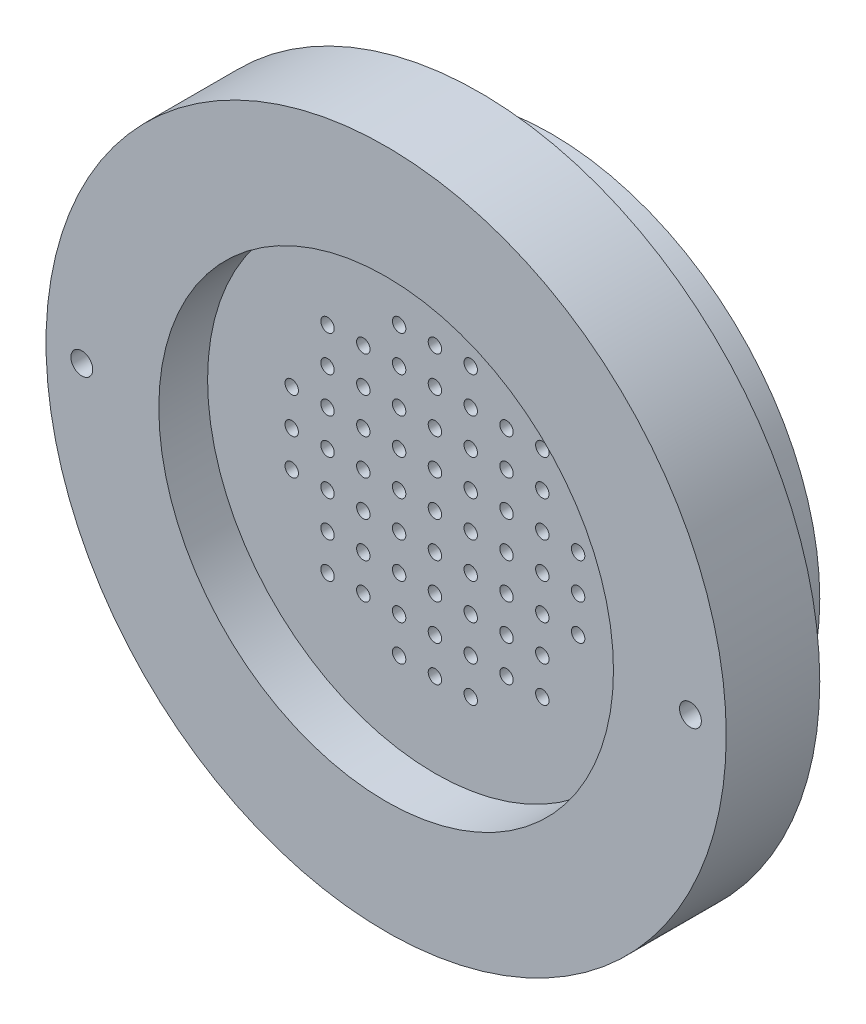
from build123d import *

# Parameters (mm, degrees)
SKETCH1_R                                           = 38
BOSS_EXTRUDE1_DEPTH                                 = 5
SKETCH2_R                                           = 0.75
CUT_EXTRUDE1_DEPTH                                  = 54.972215074
LPATTERN1_COUNT                                     = 5
LPATTERN1_PITCH                                     = 4
LPATTERN1_COUNT_DIR2                                = 5
LPATTERN1_PITCH_DIR2                                = 4
MIRROR1_COPY_1_SKETCH_R                             = 0.75
MIRROR1_COPY_1_DEPTH                                = 54.972215074
MIRROR1_COPY_2_SKETCH_R                             = 0.75
MIRROR1_COPY_2_DEPTH                                = 54.972215074
MIRROR1_COPY_3_SKETCH_R                             = 0.75
MIRROR1_COPY_3_DEPTH                                = 54.972215074
MIRROR1_COPY_4_SKETCH_R                             = 0.75
MIRROR1_COPY_4_DEPTH                                = 54.972215074
MIRROR1_COPY_5_SKETCH_R                             = 0.75
MIRROR1_COPY_5_DEPTH                                = 54.972215074
MIRROR1_COPY_6_SKETCH_R                             = 0.75
MIRROR1_COPY_6_DEPTH                                = 54.972215074
MIRROR1_COPY_7_SKETCH_R                             = 0.75
MIRROR1_COPY_7_DEPTH                                = 54.972215074
MIRROR1_COPY_8_SKETCH_R                             = 0.75
MIRROR1_COPY_8_DEPTH                                = 54.972215074
MIRROR1_COPY_9_SKETCH_R                             = 0.75
MIRROR1_COPY_9_DEPTH                                = 54.972215074
MIRROR1_COPY_10_SKETCH_R                            = 0.75
MIRROR1_COPY_10_DEPTH                               = 54.972215074
MIRROR1_COPY_11_SKETCH_R                            = 0.75
MIRROR1_COPY_11_DEPTH                               = 54.972215074
MIRROR1_COPY_12_SKETCH_R                            = 0.75
MIRROR1_COPY_12_DEPTH                               = 54.972215074
MIRROR1_COPY_13_SKETCH_R                            = 0.75
MIRROR1_COPY_13_DEPTH                               = 54.972215074
MIRROR1_COPY_14_SKETCH_R                            = 0.75
MIRROR1_COPY_14_DEPTH                               = 54.972215074
MIRROR1_COPY_15_SKETCH_R                            = 0.75
MIRROR1_COPY_15_DEPTH                               = 54.972215074
MIRROR1_COPY_16_SKETCH_R                            = 0.75
MIRROR1_COPY_16_DEPTH                               = 54.972215074
MIRROR1_COPY_17_SKETCH_R                            = 0.75
MIRROR1_COPY_17_DEPTH                               = 54.972215074
MIRROR1_COPY_18_SKETCH_R                            = 0.75
MIRROR1_COPY_18_DEPTH                               = 54.972215074
MIRROR1_COPY_19_SKETCH_R                            = 0.75
MIRROR1_COPY_19_DEPTH                               = 54.972215074
MIRROR1_COPY_20_SKETCH_R                            = 0.75
MIRROR1_COPY_20_DEPTH                               = 54.972215074
MIRROR1_AT_THE_SECOND_PLANE_COPY_1_SKETC_R          = 0.75
MIRROR1_AT_THE_SECOND_PLANE_COPY_1_DEPTH            = 54.972215074
MIRROR1_AT_THE_SECOND_PLANE_COPY_2_SKETC_R          = 0.75
MIRROR1_AT_THE_SECOND_PLANE_COPY_2_DEPTH            = 54.972215074
MIRROR1_AT_THE_SECOND_PLANE_COPY_3_SKETC_R          = 0.75
MIRROR1_AT_THE_SECOND_PLANE_COPY_3_DEPTH            = 54.972215074
MIRROR1_AT_THE_SECOND_PLANE_COPY_4_SKETC_R          = 0.75
MIRROR1_AT_THE_SECOND_PLANE_COPY_4_DEPTH            = 54.972215074
MIRROR1_AT_THE_SECOND_PLANE_COPY_5_SKETC_R          = 0.75
MIRROR1_AT_THE_SECOND_PLANE_COPY_5_DEPTH            = 54.972215074
MIRROR1_AT_THE_SECOND_PLANE_COPY_6_SKETC_R          = 0.75
MIRROR1_AT_THE_SECOND_PLANE_COPY_6_DEPTH            = 54.972215074
MIRROR1_AT_THE_SECOND_PLANE_COPY_7_SKETC_R          = 0.75
MIRROR1_AT_THE_SECOND_PLANE_COPY_7_DEPTH            = 54.972215074
MIRROR1_AT_THE_SECOND_PLANE_COPY_8_SKETC_R          = 0.75
MIRROR1_AT_THE_SECOND_PLANE_COPY_8_DEPTH            = 54.972215074
MIRROR1_AT_THE_SECOND_PLANE_COPY_9_SKETC_R          = 0.75
MIRROR1_AT_THE_SECOND_PLANE_COPY_9_DEPTH            = 54.972215074
MIRROR1_AT_THE_SECOND_PLANE_COPY_10_SKET_R          = 0.75
MIRROR1_AT_THE_SECOND_PLANE_COPY_10_DEPTH           = 54.972215074
MIRROR1_AT_THE_SECOND_PLANE_COPY_11_SKET_R          = 0.75
MIRROR1_AT_THE_SECOND_PLANE_COPY_11_DEPTH           = 54.972215074
MIRROR1_AT_THE_SECOND_PLANE_COPY_12_SKET_R          = 0.75
MIRROR1_AT_THE_SECOND_PLANE_COPY_12_DEPTH           = 54.972215074
MIRROR1_AT_THE_SECOND_PLANE_COPY_13_SKET_R          = 0.75
MIRROR1_AT_THE_SECOND_PLANE_COPY_13_DEPTH           = 54.972215074
MIRROR1_AT_THE_SECOND_PLANE_COPY_14_SKET_R          = 0.75
MIRROR1_AT_THE_SECOND_PLANE_COPY_14_DEPTH           = 54.972215074
MIRROR1_AT_THE_SECOND_PLANE_COPY_15_SKET_R          = 0.75
MIRROR1_AT_THE_SECOND_PLANE_COPY_15_DEPTH           = 54.972215074
MIRROR1_AT_THE_SECOND_PLANE_COPY_16_SKET_R          = 0.75
MIRROR1_AT_THE_SECOND_PLANE_COPY_16_DEPTH           = 54.972215074
MIRROR1_AT_THE_SECOND_PLANE_COPY_17_SKET_R          = 0.75
MIRROR1_AT_THE_SECOND_PLANE_COPY_17_DEPTH           = 54.972215074
MIRROR1_AT_THE_SECOND_PLANE_COPY_18_SKET_R          = 0.75
MIRROR1_AT_THE_SECOND_PLANE_COPY_18_DEPTH           = 54.972215074
MIRROR1_AT_THE_SECOND_PLANE_COPY_19_SKET_R          = 0.75
MIRROR1_AT_THE_SECOND_PLANE_COPY_19_DEPTH           = 54.972215074
MIRROR1_AT_THE_SECOND_PLANE_COPY_20_SKET_R          = 0.75
MIRROR1_AT_THE_SECOND_PLANE_COPY_20_DEPTH           = 54.972215074
MIRROR1_AT_THE_SECOND_PLANE_COPY_21_SKET_R          = 0.75
MIRROR1_AT_THE_SECOND_PLANE_COPY_21_DEPTH           = 54.972215074
MIRROR1_AT_THE_SECOND_PLANE_COPY_22_SKET_R          = 0.75
MIRROR1_AT_THE_SECOND_PLANE_COPY_22_DEPTH           = 54.972215074
MIRROR1_AT_THE_SECOND_PLANE_COPY_23_SKET_R          = 0.75
MIRROR1_AT_THE_SECOND_PLANE_COPY_23_DEPTH           = 54.972215074
MIRROR1_AT_THE_SECOND_PLANE_COPY_24_SKET_R          = 0.75
MIRROR1_AT_THE_SECOND_PLANE_COPY_24_DEPTH           = 54.972215074
MIRROR1_AT_THE_SECOND_PLANE_COPY_25_SKET_R          = 0.75
MIRROR1_AT_THE_SECOND_PLANE_COPY_25_DEPTH           = 54.972215074
MIRROR1_AT_THE_SECOND_PLANE_COPY_26_SKET_R          = 0.75
MIRROR1_AT_THE_SECOND_PLANE_COPY_26_DEPTH           = 54.972215074
MIRROR1_AT_THE_SECOND_PLANE_COPY_27_SKET_R          = 0.75
MIRROR1_AT_THE_SECOND_PLANE_COPY_27_DEPTH           = 54.972215074
MIRROR1_AT_THE_SECOND_PLANE_COPY_28_SKET_R          = 0.75
MIRROR1_AT_THE_SECOND_PLANE_COPY_28_DEPTH           = 54.972215074
MIRROR1_AT_THE_SECOND_PLANE_COPY_29_SKET_R          = 0.75
MIRROR1_AT_THE_SECOND_PLANE_COPY_29_DEPTH           = 54.972215074
MIRROR1_AT_THE_SECOND_PLANE_COPY_30_SKET_R          = 0.75
MIRROR1_AT_THE_SECOND_PLANE_COPY_30_DEPTH           = 54.972215074
MIRROR1_AT_THE_SECOND_PLANE_COPY_31_SKET_R          = 0.75
MIRROR1_AT_THE_SECOND_PLANE_COPY_31_DEPTH           = 54.972215074
MIRROR1_AT_THE_SECOND_PLANE_COPY_32_SKET_R          = 0.75
MIRROR1_AT_THE_SECOND_PLANE_COPY_32_DEPTH           = 54.972215074
MIRROR1_AT_THE_SECOND_PLANE_COPY_33_SKET_R          = 0.75
MIRROR1_AT_THE_SECOND_PLANE_COPY_33_DEPTH           = 54.972215074
MIRROR1_AT_THE_SECOND_PLANE_COPY_34_SKET_R          = 0.75
MIRROR1_AT_THE_SECOND_PLANE_COPY_34_DEPTH           = 54.972215074
MIRROR1_AT_THE_SECOND_PLANE_COPY_35_SKET_R          = 0.75
MIRROR1_AT_THE_SECOND_PLANE_COPY_35_DEPTH           = 54.972215074
MIRROR1_AT_THE_SECOND_PLANE_COPY_36_SKET_R          = 0.75
MIRROR1_AT_THE_SECOND_PLANE_COPY_36_DEPTH           = 54.972215074
MIRROR1_AT_THE_SECOND_PLANE_COPY_37_SKET_R          = 0.75
MIRROR1_AT_THE_SECOND_PLANE_COPY_37_DEPTH           = 54.972215074
MIRROR1_AT_THE_SECOND_PLANE_COPY_38_SKET_R          = 0.75
MIRROR1_AT_THE_SECOND_PLANE_COPY_38_DEPTH           = 54.972215074
MIRROR1_AT_THE_SECOND_PLANE_COPY_39_SKET_R          = 0.75
MIRROR1_AT_THE_SECOND_PLANE_COPY_39_DEPTH           = 54.972215074
MIRROR1_AT_THE_SECOND_PLANE_COPY_40_SKET_R          = 0.75
MIRROR1_AT_THE_SECOND_PLANE_COPY_40_DEPTH           = 54.972215074
MIRROR1_AT_THE_SECOND_PLANE_COPY_41_SKET_R          = 0.75
MIRROR1_AT_THE_SECOND_PLANE_COPY_41_DEPTH           = 54.972215074
SKETCH16_R                                          = 38
SKETCH16_R_2                                        = 25.4
BOSS_EXTRUDE2_DEPTH                                 = 5.45
BOSS_EXTRUDE3_START                                 = 8
SKETCH17_R                                          = 30
SKETCH17_R_2                                        = 25.4
BOSS_EXTRUDE3_DEPTH                                 = 8
CBORE_FOR_2_BINDING_HEAD_MACHINE_SCREW1_D           = 2.4384
CBORE_FOR_2_BINDING_HEAD_MACHINE_SCREW1_CBORE_D     = 5.55752
CBORE_FOR_2_BINDING_HEAD_MACHINE_SCREW1_CBORE_DEPTH = 1.27


with BuildPart() as part:
    # Sketch1 → Boss-Extrude1 (new body)
    with BuildSketch(Plane.XY):
        Circle(SKETCH1_R)
    extrude(amount=BOSS_EXTRUDE1_DEPTH)

    # Sketch2 → Cut-Extrude1 (cut, through all)
    with BuildSketch(Plane.XY.offset(5)):
        Circle(SKETCH2_R)
    cut_extrude1 = extrude(amount=-CUT_EXTRUDE1_DEPTH, mode=Mode.SUBTRACT)

    # LPattern1: Cut-Extrude1 5 × 5, 5 skipped
    with Locations(*[(j * LPATTERN1_PITCH_DIR2, i * LPATTERN1_PITCH, 0) for i in range(LPATTERN1_COUNT) for j in range(LPATTERN1_COUNT_DIR2) if (i, j) not in ((0, 0), (2, 4), (3, 4), (4, 2), (4, 3), (4, 4))]):
        add(cut_extrude1, mode=Mode.SUBTRACT)

    # Mirror1 copy 1 sketch → Mirror1 copy 1 (cut, through all)
    with BuildSketch(Plane(origin=(-4, 0, 5), x_dir=(-1, 0, 0), z_dir=(0, 0, 1))):
        Circle(MIRROR1_COPY_1_SKETCH_R)
    extrude(amount=-MIRROR1_COPY_1_DEPTH, mode=Mode.SUBTRACT)

    # Mirror1 copy 2 sketch → Mirror1 copy 2 (cut, through all)
    with BuildSketch(Plane(origin=(-8, 0, 5), x_dir=(-1, 0, 0), z_dir=(0, 0, 1))):
        Circle(MIRROR1_COPY_2_SKETCH_R)
    extrude(amount=-MIRROR1_COPY_2_DEPTH, mode=Mode.SUBTRACT)

    # Mirror1 copy 3 sketch → Mirror1 copy 3 (cut, through all)
    with BuildSketch(Plane(origin=(-12, 0, 5), x_dir=(-1, 0, 0), z_dir=(0, 0, 1))):
        Circle(MIRROR1_COPY_3_SKETCH_R)
    extrude(amount=-MIRROR1_COPY_3_DEPTH, mode=Mode.SUBTRACT)

    # Mirror1 copy 4 sketch → Mirror1 copy 4 (cut, through all)
    with BuildSketch(Plane(origin=(-16, 0, 5), x_dir=(-1, 0, 0), z_dir=(0, 0, 1))):
        Circle(MIRROR1_COPY_4_SKETCH_R)
    extrude(amount=-MIRROR1_COPY_4_DEPTH, mode=Mode.SUBTRACT)

    # Mirror1 copy 5 sketch → Mirror1 copy 5 (cut, through all)
    with BuildSketch(Plane(origin=(0, 4, 5), x_dir=(-1, 0, 0), z_dir=(0, 0, 1))):
        Circle(MIRROR1_COPY_5_SKETCH_R)
    extrude(amount=-MIRROR1_COPY_5_DEPTH, mode=Mode.SUBTRACT)

    # Mirror1 copy 6 sketch → Mirror1 copy 6 (cut, through all)
    with BuildSketch(Plane(origin=(-4, 4, 5), x_dir=(-1, 0, 0), z_dir=(0, 0, 1))):
        Circle(MIRROR1_COPY_6_SKETCH_R)
    extrude(amount=-MIRROR1_COPY_6_DEPTH, mode=Mode.SUBTRACT)

    # Mirror1 copy 7 sketch → Mirror1 copy 7 (cut, through all)
    with BuildSketch(Plane(origin=(-8, 4, 5), x_dir=(-1, 0, 0), z_dir=(0, 0, 1))):
        Circle(MIRROR1_COPY_7_SKETCH_R)
    extrude(amount=-MIRROR1_COPY_7_DEPTH, mode=Mode.SUBTRACT)

    # Mirror1 copy 8 sketch → Mirror1 copy 8 (cut, through all)
    with BuildSketch(Plane(origin=(-12, 4, 5), x_dir=(-1, 0, 0), z_dir=(0, 0, 1))):
        Circle(MIRROR1_COPY_8_SKETCH_R)
    extrude(amount=-MIRROR1_COPY_8_DEPTH, mode=Mode.SUBTRACT)

    # Mirror1 copy 9 sketch → Mirror1 copy 9 (cut, through all)
    with BuildSketch(Plane(origin=(-16, 4, 5), x_dir=(-1, 0, 0), z_dir=(0, 0, 1))):
        Circle(MIRROR1_COPY_9_SKETCH_R)
    extrude(amount=-MIRROR1_COPY_9_DEPTH, mode=Mode.SUBTRACT)

    # Mirror1 copy 10 sketch → Mirror1 copy 10 (cut, through all)
    with BuildSketch(Plane(origin=(0, 8, 5), x_dir=(-1, 0, 0), z_dir=(0, 0, 1))):
        Circle(MIRROR1_COPY_10_SKETCH_R)
    extrude(amount=-MIRROR1_COPY_10_DEPTH, mode=Mode.SUBTRACT)

    # Mirror1 copy 11 sketch → Mirror1 copy 11 (cut, through all)
    with BuildSketch(Plane(origin=(-4, 8, 5), x_dir=(-1, 0, 0), z_dir=(0, 0, 1))):
        Circle(MIRROR1_COPY_11_SKETCH_R)
    extrude(amount=-MIRROR1_COPY_11_DEPTH, mode=Mode.SUBTRACT)

    # Mirror1 copy 12 sketch → Mirror1 copy 12 (cut, through all)
    with BuildSketch(Plane(origin=(-8, 8, 5), x_dir=(-1, 0, 0), z_dir=(0, 0, 1))):
        Circle(MIRROR1_COPY_12_SKETCH_R)
    extrude(amount=-MIRROR1_COPY_12_DEPTH, mode=Mode.SUBTRACT)

    # Mirror1 copy 13 sketch → Mirror1 copy 13 (cut, through all)
    with BuildSketch(Plane(origin=(-12, 8, 5), x_dir=(-1, 0, 0), z_dir=(0, 0, 1))):
        Circle(MIRROR1_COPY_13_SKETCH_R)
    extrude(amount=-MIRROR1_COPY_13_DEPTH, mode=Mode.SUBTRACT)

    # Mirror1 copy 14 sketch → Mirror1 copy 14 (cut, through all)
    with BuildSketch(Plane(origin=(0, 12, 5), x_dir=(-1, 0, 0), z_dir=(0, 0, 1))):
        Circle(MIRROR1_COPY_14_SKETCH_R)
    extrude(amount=-MIRROR1_COPY_14_DEPTH, mode=Mode.SUBTRACT)

    # Mirror1 copy 15 sketch → Mirror1 copy 15 (cut, through all)
    with BuildSketch(Plane(origin=(-4, 12, 5), x_dir=(-1, 0, 0), z_dir=(0, 0, 1))):
        Circle(MIRROR1_COPY_15_SKETCH_R)
    extrude(amount=-MIRROR1_COPY_15_DEPTH, mode=Mode.SUBTRACT)

    # Mirror1 copy 16 sketch → Mirror1 copy 16 (cut, through all)
    with BuildSketch(Plane(origin=(-8, 12, 5), x_dir=(-1, 0, 0), z_dir=(0, 0, 1))):
        Circle(MIRROR1_COPY_16_SKETCH_R)
    extrude(amount=-MIRROR1_COPY_16_DEPTH, mode=Mode.SUBTRACT)

    # Mirror1 copy 17 sketch → Mirror1 copy 17 (cut, through all)
    with BuildSketch(Plane(origin=(-12, 12, 5), x_dir=(-1, 0, 0), z_dir=(0, 0, 1))):
        Circle(MIRROR1_COPY_17_SKETCH_R)
    extrude(amount=-MIRROR1_COPY_17_DEPTH, mode=Mode.SUBTRACT)

    # Mirror1 copy 18 sketch → Mirror1 copy 18 (cut, through all)
    with BuildSketch(Plane(origin=(0, 16, 5), x_dir=(-1, 0, 0), z_dir=(0, 0, 1))):
        Circle(MIRROR1_COPY_18_SKETCH_R)
    extrude(amount=-MIRROR1_COPY_18_DEPTH, mode=Mode.SUBTRACT)

    # Mirror1 copy 19 sketch → Mirror1 copy 19 (cut, through all)
    with BuildSketch(Plane(origin=(-4, 16, 5), x_dir=(-1, 0, 0), z_dir=(0, 0, 1))):
        Circle(MIRROR1_COPY_19_SKETCH_R)
    extrude(amount=-MIRROR1_COPY_19_DEPTH, mode=Mode.SUBTRACT)

    # Mirror1 copy 20 sketch → Mirror1 copy 20 (cut, through all)
    with BuildSketch(Plane(origin=(0, 0, 5), x_dir=(-1, 0, 0), z_dir=(0, 0, 1))):
        Circle(MIRROR1_COPY_20_SKETCH_R)
    extrude(amount=-MIRROR1_COPY_20_DEPTH, mode=Mode.SUBTRACT)

    # Mirror1 at the second plane copy 1 sketc → Mirror1 at the second plane copy 1 (cut, through all)
    with BuildSketch(Plane(origin=(4, 0, 5), x_dir=(1, 0, 0), z_dir=(0, 0, 1))):
        Circle(MIRROR1_AT_THE_SECOND_PLANE_COPY_1_SKETC_R)
    extrude(amount=-MIRROR1_AT_THE_SECOND_PLANE_COPY_1_DEPTH, mode=Mode.SUBTRACT)

    # Mirror1 at the second plane copy 2 sketc → Mirror1 at the second plane copy 2 (cut, through all)
    with BuildSketch(Plane(origin=(8, 0, 5), x_dir=(1, 0, 0), z_dir=(0, 0, 1))):
        Circle(MIRROR1_AT_THE_SECOND_PLANE_COPY_2_SKETC_R)
    extrude(amount=-MIRROR1_AT_THE_SECOND_PLANE_COPY_2_DEPTH, mode=Mode.SUBTRACT)

    # Mirror1 at the second plane copy 3 sketc → Mirror1 at the second plane copy 3 (cut, through all)
    with BuildSketch(Plane(origin=(12, 0, 5), x_dir=(1, 0, 0), z_dir=(0, 0, 1))):
        Circle(MIRROR1_AT_THE_SECOND_PLANE_COPY_3_SKETC_R)
    extrude(amount=-MIRROR1_AT_THE_SECOND_PLANE_COPY_3_DEPTH, mode=Mode.SUBTRACT)

    # Mirror1 at the second plane copy 4 sketc → Mirror1 at the second plane copy 4 (cut, through all)
    with BuildSketch(Plane(origin=(16, 0, 5), x_dir=(1, 0, 0), z_dir=(0, 0, 1))):
        Circle(MIRROR1_AT_THE_SECOND_PLANE_COPY_4_SKETC_R)
    extrude(amount=-MIRROR1_AT_THE_SECOND_PLANE_COPY_4_DEPTH, mode=Mode.SUBTRACT)

    # Mirror1 at the second plane copy 5 sketc → Mirror1 at the second plane copy 5 (cut, through all)
    with BuildSketch(Plane(origin=(0, -4, 5), x_dir=(1, 0, 0), z_dir=(0, 0, 1))):
        Circle(MIRROR1_AT_THE_SECOND_PLANE_COPY_5_SKETC_R)
    extrude(amount=-MIRROR1_AT_THE_SECOND_PLANE_COPY_5_DEPTH, mode=Mode.SUBTRACT)

    # Mirror1 at the second plane copy 6 sketc → Mirror1 at the second plane copy 6 (cut, through all)
    with BuildSketch(Plane(origin=(4, -4, 5), x_dir=(1, 0, 0), z_dir=(0, 0, 1))):
        Circle(MIRROR1_AT_THE_SECOND_PLANE_COPY_6_SKETC_R)
    extrude(amount=-MIRROR1_AT_THE_SECOND_PLANE_COPY_6_DEPTH, mode=Mode.SUBTRACT)

    # Mirror1 at the second plane copy 7 sketc → Mirror1 at the second plane copy 7 (cut, through all)
    with BuildSketch(Plane(origin=(8, -4, 5), x_dir=(1, 0, 0), z_dir=(0, 0, 1))):
        Circle(MIRROR1_AT_THE_SECOND_PLANE_COPY_7_SKETC_R)
    extrude(amount=-MIRROR1_AT_THE_SECOND_PLANE_COPY_7_DEPTH, mode=Mode.SUBTRACT)

    # Mirror1 at the second plane copy 8 sketc → Mirror1 at the second plane copy 8 (cut, through all)
    with BuildSketch(Plane(origin=(12, -4, 5), x_dir=(1, 0, 0), z_dir=(0, 0, 1))):
        Circle(MIRROR1_AT_THE_SECOND_PLANE_COPY_8_SKETC_R)
    extrude(amount=-MIRROR1_AT_THE_SECOND_PLANE_COPY_8_DEPTH, mode=Mode.SUBTRACT)

    # Mirror1 at the second plane copy 9 sketc → Mirror1 at the second plane copy 9 (cut, through all)
    with BuildSketch(Plane(origin=(16, -4, 5), x_dir=(1, 0, 0), z_dir=(0, 0, 1))):
        Circle(MIRROR1_AT_THE_SECOND_PLANE_COPY_9_SKETC_R)
    extrude(amount=-MIRROR1_AT_THE_SECOND_PLANE_COPY_9_DEPTH, mode=Mode.SUBTRACT)

    # Mirror1 at the second plane copy 10 sket → Mirror1 at the second plane copy 10 (cut, through all)
    with BuildSketch(Plane(origin=(0, -8, 5), x_dir=(1, 0, 0), z_dir=(0, 0, 1))):
        Circle(MIRROR1_AT_THE_SECOND_PLANE_COPY_10_SKET_R)
    extrude(amount=-MIRROR1_AT_THE_SECOND_PLANE_COPY_10_DEPTH, mode=Mode.SUBTRACT)

    # Mirror1 at the second plane copy 11 sket → Mirror1 at the second plane copy 11 (cut, through all)
    with BuildSketch(Plane(origin=(4, -8, 5), x_dir=(1, 0, 0), z_dir=(0, 0, 1))):
        Circle(MIRROR1_AT_THE_SECOND_PLANE_COPY_11_SKET_R)
    extrude(amount=-MIRROR1_AT_THE_SECOND_PLANE_COPY_11_DEPTH, mode=Mode.SUBTRACT)

    # Mirror1 at the second plane copy 12 sket → Mirror1 at the second plane copy 12 (cut, through all)
    with BuildSketch(Plane(origin=(8, -8, 5), x_dir=(1, 0, 0), z_dir=(0, 0, 1))):
        Circle(MIRROR1_AT_THE_SECOND_PLANE_COPY_12_SKET_R)
    extrude(amount=-MIRROR1_AT_THE_SECOND_PLANE_COPY_12_DEPTH, mode=Mode.SUBTRACT)

    # Mirror1 at the second plane copy 13 sket → Mirror1 at the second plane copy 13 (cut, through all)
    with BuildSketch(Plane(origin=(12, -8, 5), x_dir=(1, 0, 0), z_dir=(0, 0, 1))):
        Circle(MIRROR1_AT_THE_SECOND_PLANE_COPY_13_SKET_R)
    extrude(amount=-MIRROR1_AT_THE_SECOND_PLANE_COPY_13_DEPTH, mode=Mode.SUBTRACT)

    # Mirror1 at the second plane copy 14 sket → Mirror1 at the second plane copy 14 (cut, through all)
    with BuildSketch(Plane(origin=(0, -12, 5), x_dir=(1, 0, 0), z_dir=(0, 0, 1))):
        Circle(MIRROR1_AT_THE_SECOND_PLANE_COPY_14_SKET_R)
    extrude(amount=-MIRROR1_AT_THE_SECOND_PLANE_COPY_14_DEPTH, mode=Mode.SUBTRACT)

    # Mirror1 at the second plane copy 15 sket → Mirror1 at the second plane copy 15 (cut, through all)
    with BuildSketch(Plane(origin=(4, -12, 5), x_dir=(1, 0, 0), z_dir=(0, 0, 1))):
        Circle(MIRROR1_AT_THE_SECOND_PLANE_COPY_15_SKET_R)
    extrude(amount=-MIRROR1_AT_THE_SECOND_PLANE_COPY_15_DEPTH, mode=Mode.SUBTRACT)

    # Mirror1 at the second plane copy 16 sket → Mirror1 at the second plane copy 16 (cut, through all)
    with BuildSketch(Plane(origin=(8, -12, 5), x_dir=(1, 0, 0), z_dir=(0, 0, 1))):
        Circle(MIRROR1_AT_THE_SECOND_PLANE_COPY_16_SKET_R)
    extrude(amount=-MIRROR1_AT_THE_SECOND_PLANE_COPY_16_DEPTH, mode=Mode.SUBTRACT)

    # Mirror1 at the second plane copy 17 sket → Mirror1 at the second plane copy 17 (cut, through all)
    with BuildSketch(Plane(origin=(12, -12, 5), x_dir=(1, 0, 0), z_dir=(0, 0, 1))):
        Circle(MIRROR1_AT_THE_SECOND_PLANE_COPY_17_SKET_R)
    extrude(amount=-MIRROR1_AT_THE_SECOND_PLANE_COPY_17_DEPTH, mode=Mode.SUBTRACT)

    # Mirror1 at the second plane copy 18 sket → Mirror1 at the second plane copy 18 (cut, through all)
    with BuildSketch(Plane(origin=(0, -16, 5), x_dir=(1, 0, 0), z_dir=(0, 0, 1))):
        Circle(MIRROR1_AT_THE_SECOND_PLANE_COPY_18_SKET_R)
    extrude(amount=-MIRROR1_AT_THE_SECOND_PLANE_COPY_18_DEPTH, mode=Mode.SUBTRACT)

    # Mirror1 at the second plane copy 19 sket → Mirror1 at the second plane copy 19 (cut, through all)
    with BuildSketch(Plane(origin=(4, -16, 5), x_dir=(1, 0, 0), z_dir=(0, 0, 1))):
        Circle(MIRROR1_AT_THE_SECOND_PLANE_COPY_19_SKET_R)
    extrude(amount=-MIRROR1_AT_THE_SECOND_PLANE_COPY_19_DEPTH, mode=Mode.SUBTRACT)

    # Mirror1 at the second plane copy 20 sket → Mirror1 at the second plane copy 20 (cut, through all)
    with BuildSketch(Plane.XY.offset(5)):
        Circle(MIRROR1_AT_THE_SECOND_PLANE_COPY_20_SKET_R)
    extrude(amount=-MIRROR1_AT_THE_SECOND_PLANE_COPY_20_DEPTH, mode=Mode.SUBTRACT)

    # Mirror1 at the second plane copy 21 sket → Mirror1 at the second plane copy 21 (cut, through all)
    with BuildSketch(Plane(origin=(-4, 0, 5), x_dir=(-1, 0, 0), z_dir=(0, 0, 1))):
        Circle(MIRROR1_AT_THE_SECOND_PLANE_COPY_21_SKET_R)
    extrude(amount=-MIRROR1_AT_THE_SECOND_PLANE_COPY_21_DEPTH, mode=Mode.SUBTRACT)

    # Mirror1 at the second plane copy 22 sket → Mirror1 at the second plane copy 22 (cut, through all)
    with BuildSketch(Plane(origin=(-8, 0, 5), x_dir=(-1, 0, 0), z_dir=(0, 0, 1))):
        Circle(MIRROR1_AT_THE_SECOND_PLANE_COPY_22_SKET_R)
    extrude(amount=-MIRROR1_AT_THE_SECOND_PLANE_COPY_22_DEPTH, mode=Mode.SUBTRACT)

    # Mirror1 at the second plane copy 23 sket → Mirror1 at the second plane copy 23 (cut, through all)
    with BuildSketch(Plane(origin=(-12, 0, 5), x_dir=(-1, 0, 0), z_dir=(0, 0, 1))):
        Circle(MIRROR1_AT_THE_SECOND_PLANE_COPY_23_SKET_R)
    extrude(amount=-MIRROR1_AT_THE_SECOND_PLANE_COPY_23_DEPTH, mode=Mode.SUBTRACT)

    # Mirror1 at the second plane copy 24 sket → Mirror1 at the second plane copy 24 (cut, through all)
    with BuildSketch(Plane(origin=(-16, 0, 5), x_dir=(-1, 0, 0), z_dir=(0, 0, 1))):
        Circle(MIRROR1_AT_THE_SECOND_PLANE_COPY_24_SKET_R)
    extrude(amount=-MIRROR1_AT_THE_SECOND_PLANE_COPY_24_DEPTH, mode=Mode.SUBTRACT)

    # Mirror1 at the second plane copy 25 sket → Mirror1 at the second plane copy 25 (cut, through all)
    with BuildSketch(Plane(origin=(0, -4, 5), x_dir=(-1, 0, 0), z_dir=(0, 0, 1))):
        Circle(MIRROR1_AT_THE_SECOND_PLANE_COPY_25_SKET_R)
    extrude(amount=-MIRROR1_AT_THE_SECOND_PLANE_COPY_25_DEPTH, mode=Mode.SUBTRACT)

    # Mirror1 at the second plane copy 26 sket → Mirror1 at the second plane copy 26 (cut, through all)
    with BuildSketch(Plane(origin=(-4, -4, 5), x_dir=(-1, 0, 0), z_dir=(0, 0, 1))):
        Circle(MIRROR1_AT_THE_SECOND_PLANE_COPY_26_SKET_R)
    extrude(amount=-MIRROR1_AT_THE_SECOND_PLANE_COPY_26_DEPTH, mode=Mode.SUBTRACT)

    # Mirror1 at the second plane copy 27 sket → Mirror1 at the second plane copy 27 (cut, through all)
    with BuildSketch(Plane(origin=(-8, -4, 5), x_dir=(-1, 0, 0), z_dir=(0, 0, 1))):
        Circle(MIRROR1_AT_THE_SECOND_PLANE_COPY_27_SKET_R)
    extrude(amount=-MIRROR1_AT_THE_SECOND_PLANE_COPY_27_DEPTH, mode=Mode.SUBTRACT)

    # Mirror1 at the second plane copy 28 sket → Mirror1 at the second plane copy 28 (cut, through all)
    with BuildSketch(Plane(origin=(-12, -4, 5), x_dir=(-1, 0, 0), z_dir=(0, 0, 1))):
        Circle(MIRROR1_AT_THE_SECOND_PLANE_COPY_28_SKET_R)
    extrude(amount=-MIRROR1_AT_THE_SECOND_PLANE_COPY_28_DEPTH, mode=Mode.SUBTRACT)

    # Mirror1 at the second plane copy 29 sket → Mirror1 at the second plane copy 29 (cut, through all)
    with BuildSketch(Plane(origin=(-16, -4, 5), x_dir=(-1, 0, 0), z_dir=(0, 0, 1))):
        Circle(MIRROR1_AT_THE_SECOND_PLANE_COPY_29_SKET_R)
    extrude(amount=-MIRROR1_AT_THE_SECOND_PLANE_COPY_29_DEPTH, mode=Mode.SUBTRACT)

    # Mirror1 at the second plane copy 30 sket → Mirror1 at the second plane copy 30 (cut, through all)
    with BuildSketch(Plane(origin=(0, -8, 5), x_dir=(-1, 0, 0), z_dir=(0, 0, 1))):
        Circle(MIRROR1_AT_THE_SECOND_PLANE_COPY_30_SKET_R)
    extrude(amount=-MIRROR1_AT_THE_SECOND_PLANE_COPY_30_DEPTH, mode=Mode.SUBTRACT)

    # Mirror1 at the second plane copy 31 sket → Mirror1 at the second plane copy 31 (cut, through all)
    with BuildSketch(Plane(origin=(-4, -8, 5), x_dir=(-1, 0, 0), z_dir=(0, 0, 1))):
        Circle(MIRROR1_AT_THE_SECOND_PLANE_COPY_31_SKET_R)
    extrude(amount=-MIRROR1_AT_THE_SECOND_PLANE_COPY_31_DEPTH, mode=Mode.SUBTRACT)

    # Mirror1 at the second plane copy 32 sket → Mirror1 at the second plane copy 32 (cut, through all)
    with BuildSketch(Plane(origin=(-8, -8, 5), x_dir=(-1, 0, 0), z_dir=(0, 0, 1))):
        Circle(MIRROR1_AT_THE_SECOND_PLANE_COPY_32_SKET_R)
    extrude(amount=-MIRROR1_AT_THE_SECOND_PLANE_COPY_32_DEPTH, mode=Mode.SUBTRACT)

    # Mirror1 at the second plane copy 33 sket → Mirror1 at the second plane copy 33 (cut, through all)
    with BuildSketch(Plane(origin=(-12, -8, 5), x_dir=(-1, 0, 0), z_dir=(0, 0, 1))):
        Circle(MIRROR1_AT_THE_SECOND_PLANE_COPY_33_SKET_R)
    extrude(amount=-MIRROR1_AT_THE_SECOND_PLANE_COPY_33_DEPTH, mode=Mode.SUBTRACT)

    # Mirror1 at the second plane copy 34 sket → Mirror1 at the second plane copy 34 (cut, through all)
    with BuildSketch(Plane(origin=(0, -12, 5), x_dir=(-1, 0, 0), z_dir=(0, 0, 1))):
        Circle(MIRROR1_AT_THE_SECOND_PLANE_COPY_34_SKET_R)
    extrude(amount=-MIRROR1_AT_THE_SECOND_PLANE_COPY_34_DEPTH, mode=Mode.SUBTRACT)

    # Mirror1 at the second plane copy 35 sket → Mirror1 at the second plane copy 35 (cut, through all)
    with BuildSketch(Plane(origin=(-4, -12, 5), x_dir=(-1, 0, 0), z_dir=(0, 0, 1))):
        Circle(MIRROR1_AT_THE_SECOND_PLANE_COPY_35_SKET_R)
    extrude(amount=-MIRROR1_AT_THE_SECOND_PLANE_COPY_35_DEPTH, mode=Mode.SUBTRACT)

    # Mirror1 at the second plane copy 36 sket → Mirror1 at the second plane copy 36 (cut, through all)
    with BuildSketch(Plane(origin=(-8, -12, 5), x_dir=(-1, 0, 0), z_dir=(0, 0, 1))):
        Circle(MIRROR1_AT_THE_SECOND_PLANE_COPY_36_SKET_R)
    extrude(amount=-MIRROR1_AT_THE_SECOND_PLANE_COPY_36_DEPTH, mode=Mode.SUBTRACT)

    # Mirror1 at the second plane copy 37 sket → Mirror1 at the second plane copy 37 (cut, through all)
    with BuildSketch(Plane(origin=(-12, -12, 5), x_dir=(-1, 0, 0), z_dir=(0, 0, 1))):
        Circle(MIRROR1_AT_THE_SECOND_PLANE_COPY_37_SKET_R)
    extrude(amount=-MIRROR1_AT_THE_SECOND_PLANE_COPY_37_DEPTH, mode=Mode.SUBTRACT)

    # Mirror1 at the second plane copy 38 sket → Mirror1 at the second plane copy 38 (cut, through all)
    with BuildSketch(Plane(origin=(0, -16, 5), x_dir=(-1, 0, 0), z_dir=(0, 0, 1))):
        Circle(MIRROR1_AT_THE_SECOND_PLANE_COPY_38_SKET_R)
    extrude(amount=-MIRROR1_AT_THE_SECOND_PLANE_COPY_38_DEPTH, mode=Mode.SUBTRACT)

    # Mirror1 at the second plane copy 39 sket → Mirror1 at the second plane copy 39 (cut, through all)
    with BuildSketch(Plane(origin=(-4, -16, 5), x_dir=(-1, 0, 0), z_dir=(0, 0, 1))):
        Circle(MIRROR1_AT_THE_SECOND_PLANE_COPY_39_SKET_R)
    extrude(amount=-MIRROR1_AT_THE_SECOND_PLANE_COPY_39_DEPTH, mode=Mode.SUBTRACT)

    # Mirror1 at the second plane copy 40 sket → Mirror1 at the second plane copy 40 (cut, through all)
    with BuildSketch(Plane(origin=(0, 0, 5), x_dir=(-1, 0, 0), z_dir=(0, 0, 1))):
        Circle(MIRROR1_AT_THE_SECOND_PLANE_COPY_40_SKET_R)
    extrude(amount=-MIRROR1_AT_THE_SECOND_PLANE_COPY_40_DEPTH, mode=Mode.SUBTRACT)

    # Mirror1 at the second plane copy 41 sket → Mirror1 at the second plane copy 41 (cut, through all)
    with BuildSketch(Plane.XY.offset(5)):
        Circle(MIRROR1_AT_THE_SECOND_PLANE_COPY_41_SKET_R)
    extrude(amount=-MIRROR1_AT_THE_SECOND_PLANE_COPY_41_DEPTH, mode=Mode.SUBTRACT)

    # Sketch16 → Boss-Extrude2 (add)
    with BuildSketch(Plane.XY.offset(5)):
        Circle(SKETCH16_R)
        Circle(SKETCH16_R_2, mode=Mode.SUBTRACT)
    extrude(amount=BOSS_EXTRUDE2_DEPTH)

    # Sketch17 → Boss-Extrude3 (add)
    with BuildSketch(Plane(origin=(0, 0, 0), x_dir=(-1, 0, 0), z_dir=(0, 0, -1)).offset(BOSS_EXTRUDE3_START)):
        Circle(SKETCH17_R)
        Circle(SKETCH17_R_2, mode=Mode.SUBTRACT)
    extrude(amount=-BOSS_EXTRUDE3_DEPTH)

    # CBORE for #2 Binding Head Machine Screw1 (through all)
    with Locations(Plane(origin=(0, 0, 0), x_dir=(-1, 0, 0), z_dir=(0, 0, -1))):
        with Locations((-34, 0)):
            cbore_for_2_binding_head_machine_screw1 = CounterBoreHole(CBORE_FOR_2_BINDING_HEAD_MACHINE_SCREW1_D / 2, CBORE_FOR_2_BINDING_HEAD_MACHINE_SCREW1_CBORE_D / 2, CBORE_FOR_2_BINDING_HEAD_MACHINE_SCREW1_CBORE_DEPTH)

    # Mirror2: CBORE for #2 Binding Head Machine Screw1 across plane
    add(cbore_for_2_binding_head_machine_screw1.mirror(Plane(origin=(0, 0, 0), x_dir=(0, 0, 1), z_dir=(1, 0, 0))), mode=Mode.SUBTRACT)


solid = part.part
